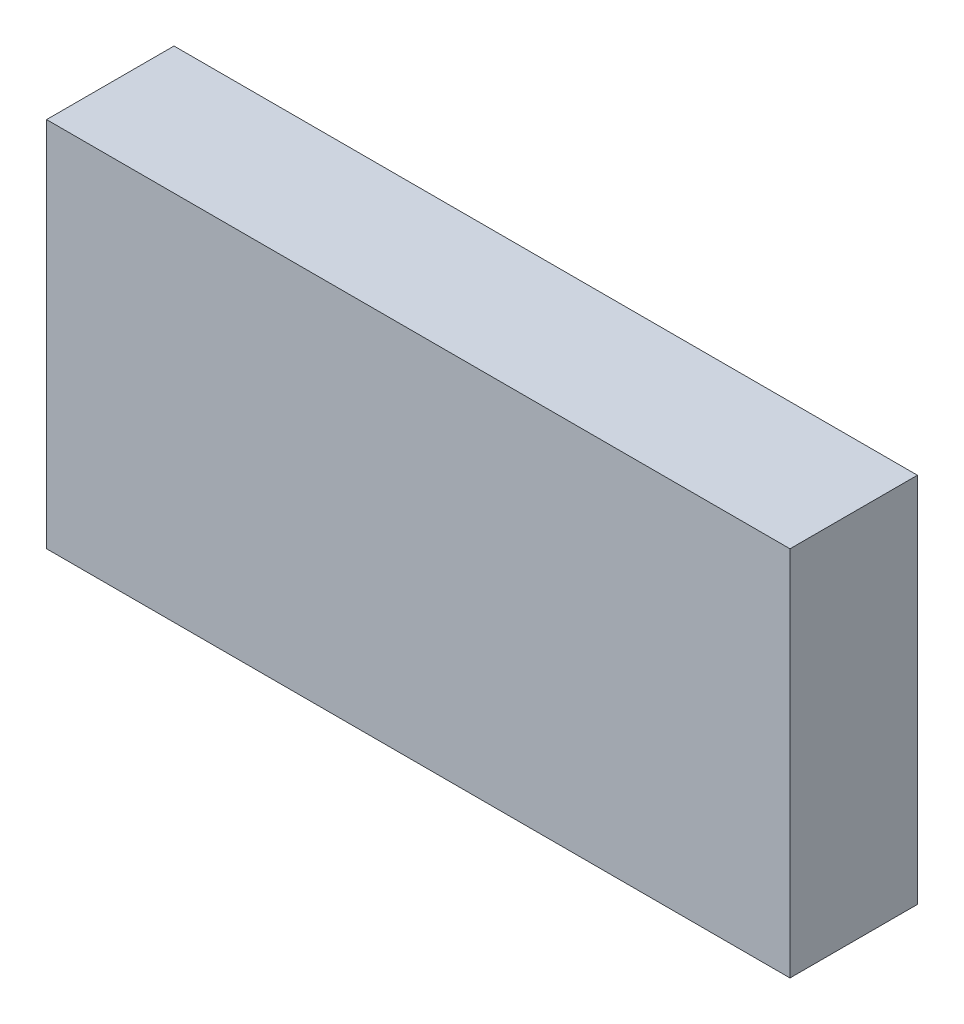
from build123d import *

# Parameters (mm, degrees)
SKETCH1_W           = 70
SKETCH1_H           = 35
BOSS_EXTRUDE1_DEPTH = 6


with BuildPart() as part:
    # Sketch1 → Boss-Extrude1 (new, symmetric)
    with BuildSketch(Plane.XY):
        Rectangle(SKETCH1_W, SKETCH1_H)
    extrude(amount=BOSS_EXTRUDE1_DEPTH, both=True)


solid = part.part
